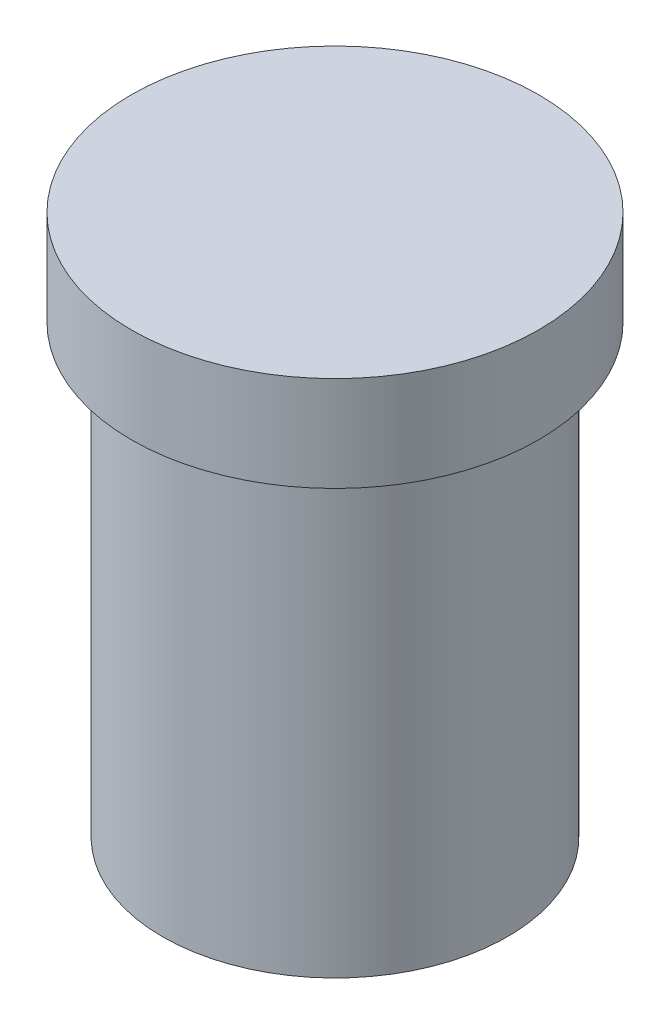
from build123d import *

# Parameters (mm, degrees)
ESBO_O1_R                = 6.85
RESSALTO_EXTRUS_O1_DEPTH = 3.2
ESBO_O3_R                = 5.8
RESSALTO_EXTRUS_O2_DEPTH = 15
ESBO_O3_2_R              = 5.8
RESSALTO_EXTRUS_O3_DEPTH = 15


with BuildPart() as part:
    # Esboço1 → Ressalto-extrusão1 (new body)
    with BuildSketch(Plane(origin=(0, 0, 0), x_dir=(1, 0, 0), z_dir=(0, 1, 0))):
        Circle(ESBO_O1_R)
    extrude(amount=RESSALTO_EXTRUS_O1_DEPTH)

    # Esboço3 → Ressalto-extrusão2 (add)
    with BuildSketch(Plane.XZ):
        Circle(ESBO_O3_R)
    extrude(amount=RESSALTO_EXTRUS_O2_DEPTH)

    # Esboço3<2> → Ressalto-extrusão3 (add)
    with BuildSketch(Plane.XZ):
        Circle(ESBO_O3_2_R)
    extrude(amount=RESSALTO_EXTRUS_O3_DEPTH)


solid = part.part
